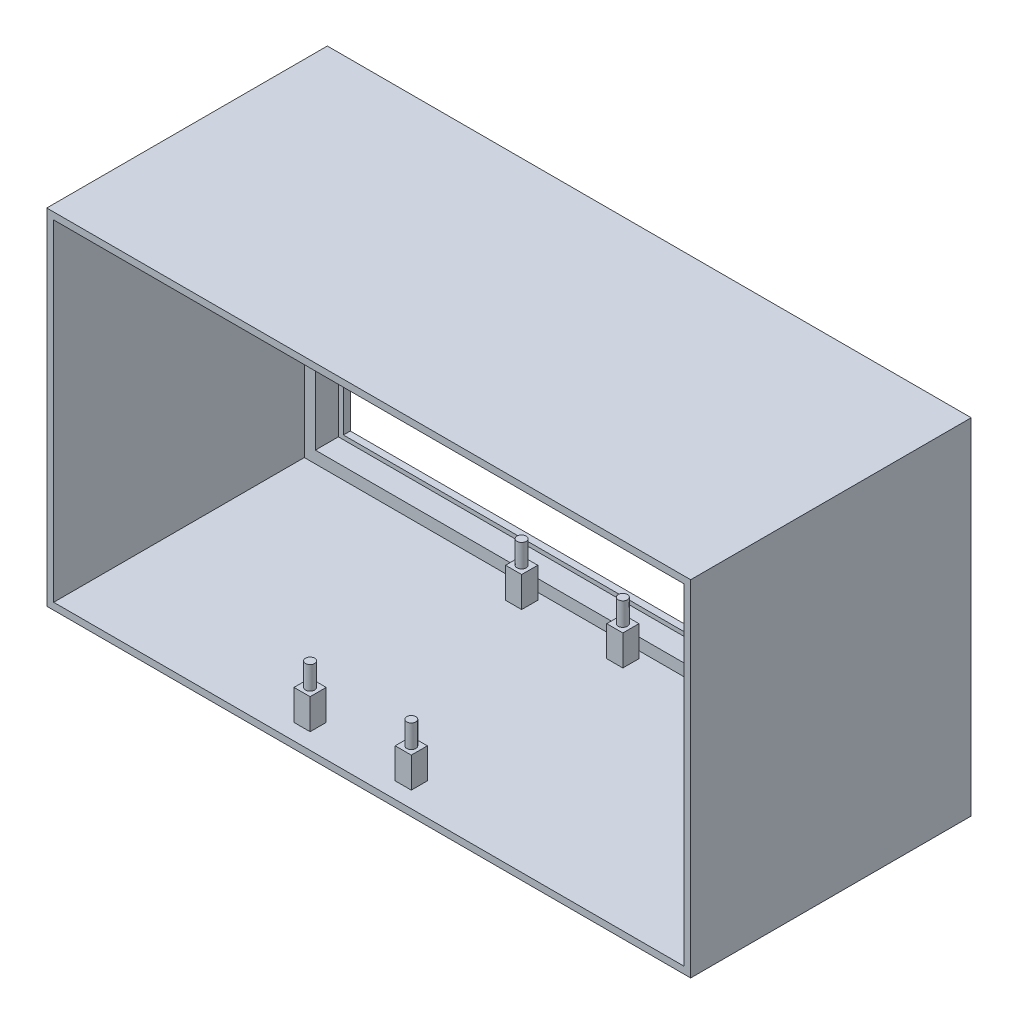
from build123d import *

# Parameters (mm, degrees)
SKETCH_1_W          = 140
SKETCH_1_H          = 75
EXTRUDE_1_DEPTH     = 61
SHELL_1_T           = -1.5
SKETCH_3_W          = 130
SKETCH_3_H          = 65
CUT_EXTRUDE_1_DEPTH = 117.308601118
SKETCH_4_W          = 137
SKETCH_4_H          = 2.6
SKETCH_4_H_2        = 3.3
EXTRUDE_2_DEPTH     = 5
SKETCH_5_W          = 2.4
SKETCH_5_H          = 69.4
EXTRUDE_3_DEPTH     = 5
SKETCH_20_W         = 3.5
SKETCH_20_H         = 3.5
EXTRUDE_4_DEPTH     = 6.6
SKETCH_21_R         = 1
EXTRUDE_5_DEPTH     = 5


with BuildPart() as part:
    # 草图1 → 凸台-拉伸1 (new body)
    with BuildSketch(Plane.XY):
        with Locations((19.248188406, -5.412137681)):
            Rectangle(SKETCH_1_W, SKETCH_1_H)
    extrude(amount=EXTRUDE_1_DEPTH)

    # 抽壳1
    shell_1_openings = [part.faces().sort_by_distance(p)[0] for p in [
        (19.248188406, -5.412137681, 61),
    ]]
    offset(amount=SHELL_1_T, openings=shell_1_openings, kind=Kind.INTERSECTION)

    # 草图3 → 切除-拉伸1 (cut, through all)
    with BuildSketch(Plane(origin=(0, 0, 0), x_dir=(-1, 0, 0), z_dir=(0, 0, -1))):
        with Locations((-19.248188406, -5.412137681)):
            Rectangle(SKETCH_3_W, SKETCH_3_H)
    extrude(amount=-CUT_EXTRUDE_1_DEPTH, mode=Mode.SUBTRACT)

    # 草图4 → 凸台-拉伸2 (add)
    with BuildSketch(Plane.XY.offset(1.5)):
        with Locations((19.248188406, -40.112137681)):
            Rectangle(SKETCH_4_W, SKETCH_4_H)
        with Locations((19.248188406, 28.937862319)):
            Rectangle(SKETCH_4_W, SKETCH_4_H_2)
    extrude(amount=EXTRUDE_2_DEPTH)

    # 草图5 → 凸台-拉伸3 (add)
    with BuildSketch(Plane.XY.offset(1.5)):
        with Locations((-48.051811594, -4.112137681)):
            Rectangle(SKETCH_5_W, SKETCH_5_H)
        with Locations((86.548188406, -4.112137681)):
            Rectangle(SKETCH_5_W, SKETCH_5_H)
    extrude(amount=EXTRUDE_3_DEPTH)

    # 草图20 → 凸台-拉伸4 (add)
    with BuildSketch(Plane(origin=(0, -41.412137681, 0), x_dir=(1, 0, 0), z_dir=(0, 1, 0))):
        with Locations((1.25, -9.75)):
            Rectangle(SKETCH_20_W, SKETCH_20_H)
        with Locations((1.25, -55.75)):
            Rectangle(SKETCH_20_W, SKETCH_20_H)
        with Locations((23.25, -55.75)):
            Rectangle(SKETCH_20_W, SKETCH_20_H)
        with Locations((23.25, -9.75)):
            Rectangle(SKETCH_20_W, SKETCH_20_H)
    extrude(amount=EXTRUDE_4_DEPTH)

    # 草图21 → 凸台-拉伸5 (add)
    with BuildSketch(Plane(origin=(0, -34.812137681, 0), x_dir=(1, 0, 0), z_dir=(0, 1, 0))):
        with Locations((1.25, -55.75)):
            Circle(SKETCH_21_R)
        with Locations((1.25, -9.75)):
            Circle(SKETCH_21_R)
        with Locations((23.25, -9.75)):
            Circle(SKETCH_21_R)
        with Locations((23.25, -55.75)):
            Circle(SKETCH_21_R)
    extrude(amount=EXTRUDE_5_DEPTH)


solid = part.part
